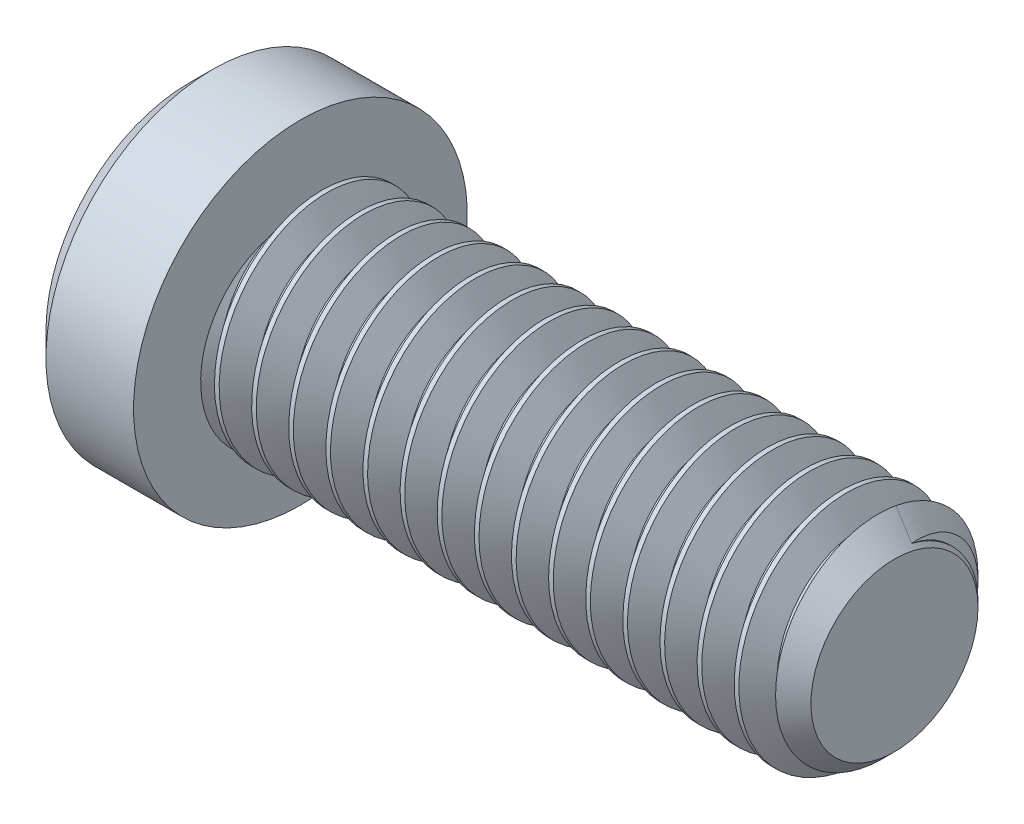
from build123d import *

# Parameters (mm, degrees)
SKETCH2_R           = 4.7625
BOSS_EXTRUDE1_DEPTH = 25.4
CHAMFER1_SIZE       = 1.190625
CUT_SWEEP1_PITCH    = 1.5875
CUT_EXTRUDE1_DEPTH  = 2.921


with BuildPart() as part:
    # Sketch2 → Boss-Extrude1 (new body)
    with BuildSketch(Plane(origin=(12.7, 0, 0), x_dir=(0, 0, -1), z_dir=(1, 0, 0))):
        Circle(SKETCH2_R)
    extrude(amount=-BOSS_EXTRUDE1_DEPTH)

    # Chamfer1
    chamfer1_edges = [part.edges().sort_by_distance(p)[0] for p in [
        (12.7, 0, 4.7625),
    ]]
    chamfer(chamfer1_edges, length=CHAMFER1_SIZE)

    # Cut-Sweep1: the profile of Sketch5 profile screwed along a right-hand helix of 17 turns, 8 arcs to a turn; built about Z, then put on its axis
    cut_sweep1_z = Axis((0, 0, 0), (0, 0, 1))
    cut_sweep1_corners = [(4.7628, 0, 0.694704455), (4.7628, 0, -0.694704455), (3.731388504, 0, -0.09921875), (3.731388504, 0, 0.09921875)]
    with BuildLine(mode=Mode.PRIVATE) as cut_sweep1_profile:
        Line(cut_sweep1_corners[0], cut_sweep1_corners[1])
        Line(cut_sweep1_corners[1], cut_sweep1_corners[2])
        Line(cut_sweep1_corners[2], cut_sweep1_corners[3])
        Line(cut_sweep1_corners[3], cut_sweep1_corners[0])
    cut_sweep1_cap = Face(cut_sweep1_profile.wire())
    cut_sweep1_turn_angles = [0, 22.5, 45, 67.5, 90, 112.5, 135, 157.5, 180, 202.5, 225, 247.5, 270, 292.5, 315, 337.5, 360]
    cut_sweep1_turn_weights = [1, 0.9238795325112867, 1, 0.9238795325112867, 1, 0.9238795325112867, 1, 0.9238795325112867, 1, 0.9238795325112867, 1, 0.9238795325112867, 1, 0.9238795325112867, 1, 0.9238795325112867, 1]
    cut_sweep1_turn_rails = [Edge.make_bspline([Vector(p[0], p[1], 0).rotate(cut_sweep1_z, cut_sweep1_turn_angles[k]) / cut_sweep1_turn_weights[k] + Vector(0, 0, p[2] + CUT_SWEEP1_PITCH * cut_sweep1_turn_angles[k] / 360) for k in range(17)], [0, 0, 0, 1, 1, 2, 2, 3, 3, 4, 4, 5, 5, 6, 6, 7, 7, 8, 8, 8], 2, cut_sweep1_turn_weights) for p in cut_sweep1_corners]
    cut_sweep1_turn_sides = [Face.make_surface_from_curves(cut_sweep1_turn_rails[p[0]], cut_sweep1_turn_rails[p[1]]) for p in [(0, 1), (1, 2), (2, 3), (3, 0)]]
    cut_sweep1 = Plane(origin=(12.7, 0, 0), x_dir=(0, 1, 0), z_dir=(-1, 0, 0)) * Solid(Shell([*[p.moved(Location((0, 0, CUT_SWEEP1_PITCH * i))) for i in range(17) for p in cut_sweep1_turn_sides], cut_sweep1_cap, cut_sweep1_cap.rotate(cut_sweep1_z, 6120).moved(Location((0, 0, CUT_SWEEP1_PITCH * 6120 / 360)))]))
    add(cut_sweep1, mode=Mode.SUBTRACT)

    # Sketch6 → Revolve1 (revolve)
    with BuildSketch(Plane.XY, mode=Mode.PRIVATE) as revolve1_sk:
        Polygon((-16.4465, 7.1374), (-17.4625, 6.1214), (-17.4625, 0), (-12.7, 0), (-12.7, 7.1374), align=None)
    revolve(revolve1_sk.sketch.rotate(Axis((-12.7, 0, 0), (-1, 0, 0)), 13.865622854), axis=Axis((-12.7, 0, 0), (-1, 0, 0)))

    # Sketch4 → Cut-Extrude1 (cut)
    with BuildSketch(Plane(origin=(-17.4625, 0, 0), x_dir=(0, 0, -1), z_dir=(1, 0, 0))):
        Polygon((0, 2.749630657), (-2.38125, 1.374815329), (-2.38125, -1.374815329), (0, -2.749630657), (2.38125, -1.374815329), (2.38125, 1.374815329), align=None)
    extrude(amount=CUT_EXTRUDE1_DEPTH, mode=Mode.SUBTRACT)

    # Cut-Extrude2 cone 1 section (through the dimple's axis) → Cut-Extrude2 (revolve, cut)
    with BuildSketch(Plane(origin=(-17.4625, 0, 0), x_dir=(0, 0, 1), z_dir=(0, 1, 0))):
        Polygon((0, 0), (2.749630657, 0), (0, 2.749630657), align=None)
    revolve(axis=Axis((-17.4625, 0, 0), (1, 0, 0)), mode=Mode.SUBTRACT)


solid = part.part
